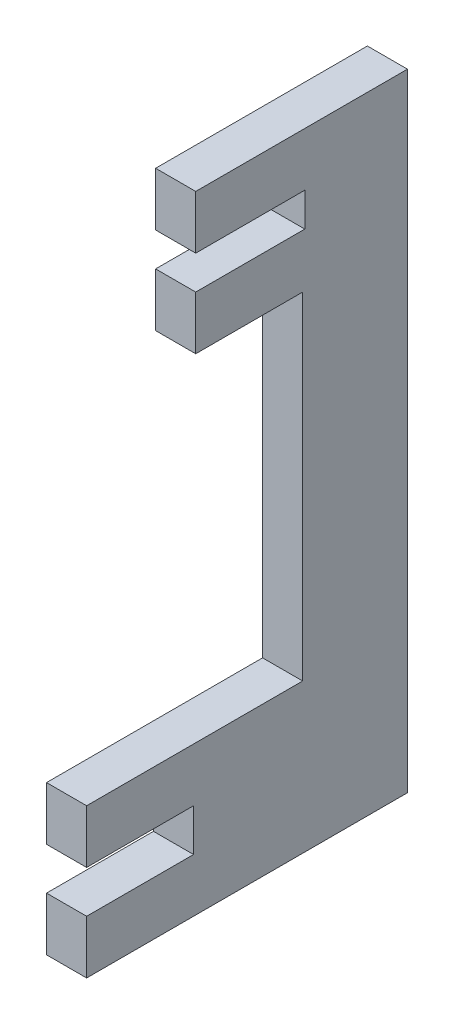
from build123d import *

# Parameters (mm, degrees)
BOSS_EXTRUDE1_DEPTH = 4.7625


with BuildPart() as part:
    # Sketch1 → Boss-Extrude1 (new body)
    with BuildSketch(Plane(origin=(0, 0, 0), x_dir=(0, 0, -1), z_dir=(1, 0, 0))):
        Polygon((-12.7, -2.50825), (-12.7, -8.85825), (25.4, -8.85825), (25.4, 65.55825), (0.254, 65.55825), (0.254, 59.20825), (13.208, 59.20825), (13.208, 55.20825), (0.254, 55.20825), (0.254, 48.85825), (12.954, 48.85825), (12.954, 8.85825), (-12.7, 8.85825), (-12.7, 2.50825), (0, 2.50825), (0, -2.50825), align=None)
    extrude(amount=BOSS_EXTRUDE1_DEPTH)


solid = part.part
